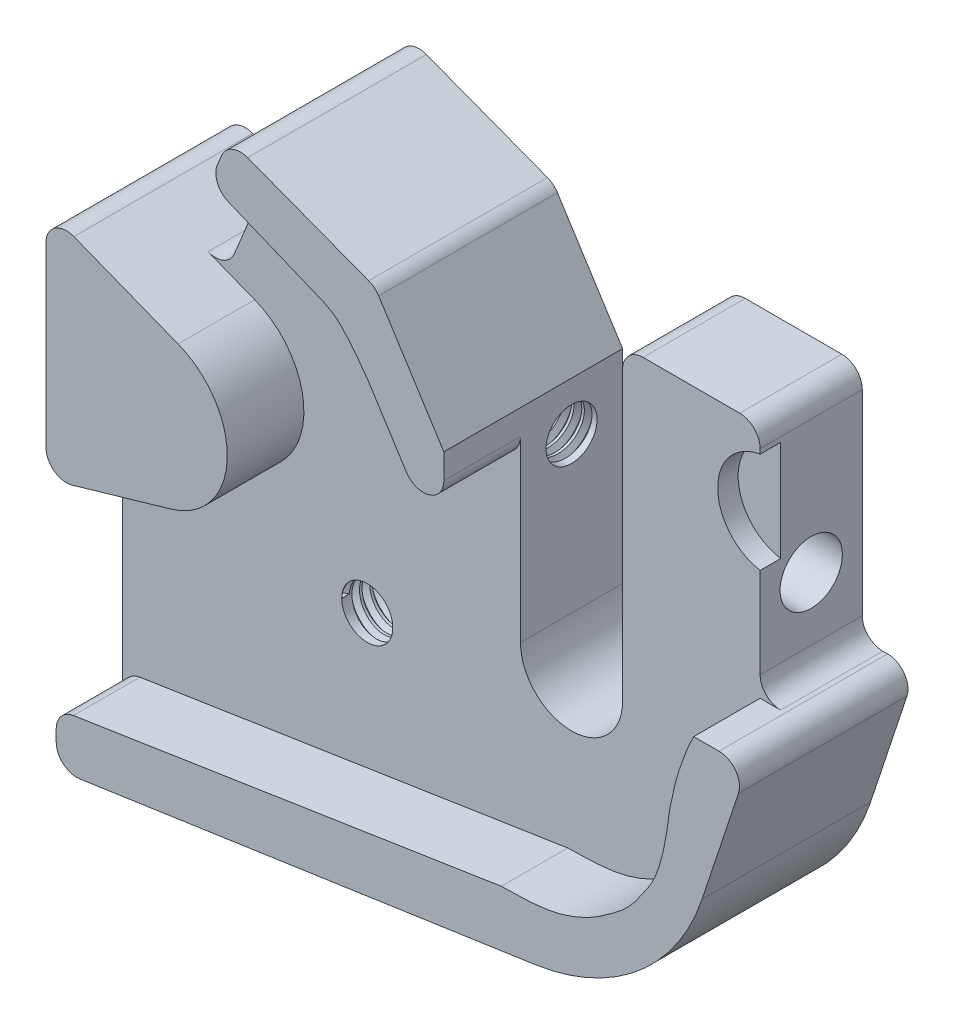
from build123d import *

# Parameters (mm, degrees)
BOSS_EXTRUDE1_DEPTH             = 10
SKETCH1_3_R                     = 7.578000113984699
BOSS_EXTRUDE2_DEPTH             = 17.5
BOSS_EXTRUDE3_DEPTH             = 16.5
SKETCH4_R                       = 3.0499999999999963
CUT_EXTRUDE2_DEPTH              = 30
TAP_DRILL_FOR_M6X1_0_TAP3_D     = 5
TAP_DRILL_FOR_M6X1_0_TAP3_DEPTH = 30
TAP_DRILL_FOR_M6X1_0_TAP3_TIP   = 1.5021515475689007
THREAD2_PITCH                   = 1
TAP_DRILL_FOR_M6X1_0_TAP4_D     = 5
TAP_DRILL_FOR_M6X1_0_TAP4_DEPTH = 30
TAP_DRILL_FOR_M6X1_0_TAP4_TIP   = 1.5021515475689007
THREAD3_PITCH                   = 1
FILLET1_R                       = 2
SKETCH16_R                      = 5.000000000000005
CUT_EXTRUDE3_DEPTH              = 2


with BuildPart() as part:
    # Sketch1 → Boss-Extrude1 (new body)
    with BuildSketch(Plane.XY):
        with BuildLine():
            Line((78.96827475522947, 38.5935556342534), (78.96827475522947, 42.187825253742076))
            Line((78.96827475522947, 42.187825253742076), (77.94135898527813, 43.80236991179886))
            Line((77.94135898527813, 43.80236991179886), (74.33675739276399, 49.46962171171273))
            ThreePointArc((74.33675739276399, 49.469621711712726), (63.688772453091616, 32.62392036907067), (72.5745325100122, 14.785744867864917))
            Line((72.5745325100123, 14.785744867865446), (83.59996436724236, 16.48818112450211))
            add(Edge.make_bspline(
                [(83.59996436724236, 16.48818112450211), (85.41724211796235, 16.53756568760866), (87.87798883539777, 16.519220276594933), (90.67264688620305, 17.4205412675626), (92.39490917260518, 18.177313617681204), (94.09982159977741, 19.337279052052818), (95.76190532502257, 20.5841697393974), (96.83810880091103, 21.893388892292066), (97.57220809756222, 23.021495021821945), (98.2993424213877, 24.012698516640828), (98.8168110615546, 25.180735972728453), (99.33817141463199, 26.79477159166982), (99.7545174529146, 28.733058812999758), (99.97921580397463, 30.878234339552698), (100.41119186805449, 32.8730475280245), (100.84339117053993, 34.69276986008277), (101.41680498340376, 36.208847575811006), (101.85717784527546, 37.44613777913256), (102.23335830846185, 38.17303090912317), (102.42203562576773, 38.57258948818388), (102.43189182699052, 38.59355563425327)],
                knots=[0, 0, 0, 0, 0.15768366072338366, 0.20676134981541355, 0.2516981863893839, 0.31900050382694334, 0.38365759589069376, 0.42951420214431174, 0.46378751400899093, 0.4995429911697522, 0.5348783172354219, 0.5730312186558052, 0.6454047552386061, 0.7048490244263054, 0.7583603601988523, 0.8208523578081605, 0.8654225677826217, 0.8976768321542437, 0.9336890739628735, 0.935681800308007, 0.935681800308007, 0.935681800308007, 0.935681800308007], degree=3))
            Line((102.43189182699051, 38.59355563425329), (88.96827475522947, 38.59355563425329))
            Line((88.96827475522946, 38.59355563425329), (88.96827475522947, 31.5935556342533))
            Line((88.96827475522947, 31.5935556342533), (88.96827475522947, 26.59355563425329))
            Line((88.96827475522947, 26.59355563425329), (83.96827475522934, 26.59355563425329))
            Line((83.96827475522934, 26.59355563425329), (78.96827475522947, 26.59355563425329))
            Line((78.96827475522947, 26.59355563425329), (78.96827475522947, 31.5935556342533))
            Line((78.96827475522947, 31.5935556342533), (78.96827475522947, 38.5935556342534))
        make_face()
        with BuildLine():
            Line((88.96827475522946, 51.27399935661806), (88.96827475522946, 43.59355563425329))
            Line((88.96827475522946, 43.59355563425329), (88.96827475522946, 38.59355563425329))
            Line((88.96827475522947, 38.59355563425329), (102.43189182699051, 38.59355563425329))
            Line((102.43189182699051, 38.593555634253285), (102.43189182699051, 40.04427807298856))
            ThreePointArc((102.43189182699052, 40.04427807298856), (96.97450370714176, 47.18707587695694), (88.96827475522963, 51.273999356618106))
        make_face()
        with BuildLine():
            Line((88.96827475522947, 61.76545821531718), (88.96827475522946, 51.27399935661806))
            ThreePointArc((88.96827475522963, 51.273999356618106), (96.97450370714176, 47.18707587695694), (102.43189182699052, 40.04427807298856))
            Line((102.43189182699051, 40.04427807298856), (102.43189182699051, 40.58090115148971))
            Line((102.43189182699051, 40.58090115148971), (102.43189182699051, 47.013590676817664))
            ThreePointArc((102.43189182699058, 47.01359067681767), (95.87453273292697, 54.36545821531712), (102.43189182699047, 61.71732575381667))
            Line((102.43189182699051, 61.71732575381667), (102.43189182699051, 61.76545821531718))
            Line((102.43189182699051, 61.76545821531718), (88.96827475522947, 61.76545821531718))
        make_face()
        with BuildLine():
            Line((88.96827475522947, 26.59355563425329), (88.96827475522947, 31.5935556342533))
            ThreePointArc((88.96827475522946, 31.5935556342533), (87.50380866116215, 28.058021728320522), (83.96827475522934, 26.59355563425331))
            Line((83.96827475522934, 26.59355563425329), (88.96827475522947, 26.59355563425329))
        make_face()
        with BuildLine():
            ThreePointArc((83.96827475522934, 26.59355563425331), (80.43274084929669, 28.058021728320615), (78.96827475522949, 31.5935556342533))
            Line((78.96827475522947, 31.5935556342533), (78.96827475522947, 26.59355563425329))
            Line((78.96827475522947, 26.59355563425329), (83.96827475522934, 26.59355563425329))
        make_face()
        with BuildLine():
            ThreePointArc((72.5745325100122, 14.785744867864917), (63.688772453091616, 32.62392036907067), (74.33675739276399, 49.469621711712726))
            Line((74.33675739276399, 49.46962171171273), (71.54074542683735, 53.865587102003296))
            add(Edge.make_bspline(
                [(67.16681294608784, 58.3330475317527), (67.53066578937492, 58.148158454940294), (68.21626704277061, 57.829717753599276), (69.73754280760359, 56.33759113466666), (70.7671129056723, 54.99803586851407), (71.54074542683735, 53.865587102003296)],
                knots=[0, 0, 0, 0, 0.19417637174294056, 0.35338295041403034, 1, 1, 1, 1], degree=3))
            Line((67.16681294608784, 58.3330475317527), (56.03811631838445, 62.90331689854259))
            Line((56.03811631838445, 62.90331689854259), (50.21233359803197, 48.7174203330503))
            Line((50.21233359803197, 48.7174203330503), (52.95464713088683, 47.643030748312306))
            ThreePointArc((52.95464713088681, 47.64303074831224), (56.45026737101809, 44.85792603920894), (57.76830437309072, 40.58721795212874))
            ThreePointArc((57.76830437309072, 40.58721795212874), (56.24935802543311, 36.03595953446999), (52.30143900683574, 33.30922401118043))
            Line((52.30143900683574, 33.30922401118043), (40.01978708427511, 29.746673468318164))
            Line((40.019787084275116, 29.746673468318164), (40.019787084275116, 9.758968623993628))
            Line((40.019787084275116, 9.758968623993628), (72.5745325100123, 14.785744867865446))
        make_face()
        with BuildLine():
            Line((102.43189182699051, 58.68401773252229), (102.43189182699051, 61.71732575381667))
            ThreePointArc((102.43189182699047, 61.71732575381667), (95.87453273292697, 54.36545821531712), (102.43189182699058, 47.01359067681767))
            Line((102.43189182699051, 47.013590676817664), (102.43189182699051, 50.04689869811206))
            ThreePointArc((102.43189182699061, 50.04689869811208), (98.87453273292698, 54.365458215317176), (102.43189182699061, 58.68401773252227))
        make_face()
        with BuildLine():
            Line((102.43189182699051, 50.04689869811206), (102.43189182699051, 58.68401773252229))
            ThreePointArc((102.43189182699061, 58.68401773252227), (98.87453273292698, 54.365458215317176), (102.43189182699061, 50.04689869811208))
        make_face()
    extrude(amount=BOSS_EXTRUDE1_DEPTH)

    # Sketch1<3> → Boss-Extrude2 (add)
    with BuildSketch(Plane.XY):
        with BuildLine():
            ThreePointArc((74.33675739276399, 49.469621711712726), (76.59709644010309, 50.514062904297106), (78.96827475522967, 51.27399935661819))
            Line((78.96827475522947, 51.27399935661824), (78.96827475522947, 51.504339637287444))
            Line((78.96827475522947, 51.504339637287444), (77.99321410117432, 53.03735628417434))
            Line((77.99321410117432, 53.03735628417434), (72.23104068023561, 62.09680067854197))
            Line((72.2310406802356, 62.09680067854197), (70.50082285395956, 62.75430218344684))
            Line((70.50082285395956, 62.75430218344684), (57.93755222306168, 67.52848103011922))
            Line((57.93755222306168, 67.52848103011922), (56.03811631838445, 62.90331689854259))
            Line((56.03811631838445, 62.90331689854259), (67.16681294608784, 58.3330475317527))
            add(Edge.make_bspline(
                [(67.16681294608784, 58.3330475317527), (67.53066578937492, 58.148158454940294), (68.21626704277061, 57.829717753599276), (69.73754280760359, 56.33759113466666), (70.7671129056723, 54.99803586851407), (71.54074542683735, 53.865587102003296)],
                knots=[0, 0, 0, 0, 0.19417637174294056, 0.35338295041403034, 1, 1, 1, 1], degree=3))
            Line((71.54074542683735, 53.865587102003296), (74.33675739276399, 49.46962171171273))
        make_face()
        with BuildLine():
            Line((78.96827475522947, 42.187825253742076), (78.96827475522947, 43.59355563425329))
            Line((78.96827475522947, 43.59355563425329), (78.96827475522947, 49.44154603091854))
            Line((78.96827475522947, 49.44154603091854), (78.96827475522947, 51.27399935661824))
            ThreePointArc((78.96827475522967, 51.27399935661819), (76.59709644010309, 50.514062904297106), (74.33675739276399, 49.469621711712726))
            Line((74.33675739276399, 49.46962171171273), (77.94135898527813, 43.80236991179886))
            Line((77.94135898527813, 43.80236991179886), (78.96827475522947, 42.187825253742076))
        make_face()
        with Locations((50.19030425910602, 40.58721795212874)):
            Circle(SKETCH1_3_R)
        with BuildLine():
            Line((52.95464713088683, 47.643030748312306), (50.21233359803197, 48.7174203330503))
            Line((50.21233359803197, 48.7174203330503), (40.01978708427513, 52.710678465331654))
            Line((40.01978708427513, 52.71067846533165), (40.01978708427513, 47.34063824296787))
            Line((40.01978708427513, 47.34063824296787), (44.49575262392416, 45.58703468895018))
            ThreePointArc((44.49575262392417, 45.58703468895018), (48.4005247200828, 47.95082949329833), (52.95464713088681, 47.64303074831224))
        make_face()
        with BuildLine():
            Line((40.01978708427513, 47.34063824296787), (40.019787084275116, 35.746673468318164))
            Line((40.01978708427511, 35.74667346831816), (43.63005434703988, 36.79390715299979))
            ThreePointArc((43.63005434703988, 36.79390715299979), (42.648765078906784, 41.32969523869845), (44.49575262392417, 45.58703468895018))
            Line((44.49575262392416, 45.58703468895018), (40.01978708427513, 47.34063824296787))
        make_face()
        with BuildLine():
            Line((40.019787084275116, 35.746673468318164), (40.019787084275116, 29.746673468318164))
            Line((40.01978708427511, 29.746673468318164), (52.30143900683574, 33.30922401118043))
            ThreePointArc((52.30143900683574, 33.30922401118043), (47.364634323302816, 33.55574050130448), (43.63005434703988, 36.79390715299979))
            Line((43.63005434703988, 36.79390715299979), (40.01978708427511, 35.74667346831816))
        make_face()
    extrude(amount=BOSS_EXTRUDE2_DEPTH)

    # Sketch1<4> → Boss-Extrude3 (add)
    with BuildSketch(Plane.XY):
        with BuildLine():
            Line((107.67772976593382, 38.59355563425329), (103.02922607223287, 38.59355563425329))
            ThreePointArc((103.02922607223283, 38.59355563425314), (103.96033667026587, 35.14845724956152), (104.27393566811703, 31.5935556342533))
            ThreePointArc((104.27393566811703, 31.593555634253295), (104.01478060289041, 28.359754711366204), (103.24393044408335, 25.208497852688204))
            Line((103.24393044408342, 25.208497852688183), (107.67772976593382, 38.59355563425329))
        make_face()
        with BuildLine():
            Line((103.02922607223287, 38.59355563425329), (102.43189182699051, 38.59355563425329))
            add(Edge.make_bspline(
                [(83.59996436724236, 16.48818112450211), (85.41724211796235, 16.53756568760866), (87.87798883539777, 16.519220276594933), (90.67264688620305, 17.4205412675626), (92.39490917260518, 18.177313617681204), (94.09982159977741, 19.337279052052818), (95.76190532502257, 20.5841697393974), (96.83810880091103, 21.893388892292066), (97.57220809756222, 23.021495021821945), (98.2993424213877, 24.012698516640828), (98.8168110615546, 25.180735972728453), (99.33817141463199, 26.79477159166982), (99.7545174529146, 28.733058812999758), (99.97921580397463, 30.878234339552698), (100.41119186805449, 32.8730475280245), (100.84339117053993, 34.69276986008277), (101.41680498340376, 36.208847575811006), (101.85717784527546, 37.44613777913256), (102.23335830846185, 38.17303090912317), (102.42203562576773, 38.57258948818388), (102.43189182699052, 38.59355563425327)],
                knots=[0, 0, 0, 0, 0.15768366072338366, 0.20676134981541355, 0.2516981863893839, 0.31900050382694334, 0.38365759589069376, 0.42951420214431174, 0.46378751400899093, 0.4995429911697522, 0.5348783172354219, 0.5730312186558052, 0.6454047552386061, 0.7048490244263054, 0.7583603601988523, 0.8208523578081605, 0.8654225677826217, 0.8976768321542437, 0.9336890739628735, 0.935681800308007, 0.935681800308007, 0.935681800308007, 0.935681800308007], degree=3))
            Line((83.59996436724236, 16.48818112450211), (72.5745325100123, 14.785744867865446))
            ThreePointArc((72.5745325100122, 14.785744867864917), (79.43931899005581, 11.799404357013096), (86.91969219864855, 11.50353323048651))
            ThreePointArc((86.91969219864855, 11.50353323048651), (97.02458391328798, 16.041942975806347), (103.24393044408335, 25.208497852688204))
            ThreePointArc((103.24393044408335, 25.208497852688204), (104.01478060289041, 28.359754711366204), (104.27393566811703, 31.593555634253295))
            ThreePointArc((104.27393566811703, 31.5935556342533), (103.96033667026587, 35.14845724956152), (103.02922607223283, 38.59355563425314))
        make_face()
        with BuildLine():
            ThreePointArc((86.91969219864855, 11.50353323048651), (79.43931899005581, 11.799404357013096), (72.5745325100122, 14.785744867864917))
            Line((72.5745325100123, 14.785744867865446), (40.019787084275116, 9.758968623993628))
            Line((40.019787084275116, 9.758968623993628), (40.019787084275116, 4.613486235158945))
            Line((40.019787084275116, 4.6134862351589465), (86.91969219864855, 11.50353323048651))
        make_face()
    extrude(amount=BOSS_EXTRUDE3_DEPTH)

    # Sketch4 → Cut-Extrude2 (cut)
    with BuildSketch(Plane.ZY.offset(-88.9682747552295)):
        with Locations((5.000000000000002, 46.76545821531712)):
            Circle(SKETCH4_R)
    extrude(amount=-CUT_EXTRUDE2_DEPTH, mode=Mode.SUBTRACT)

    # Tap Drill for M6x1.0 Tap3
    with Locations(Plane(origin=(88.968274755, 46.765458215, 5), x_dir=(0, 1, 0), z_dir=(1, 0, 0))):
        with Locations((0, 0)):
            Hole(TAP_DRILL_FOR_M6X1_0_TAP3_D / 2, depth=TAP_DRILL_FOR_M6X1_0_TAP3_DEPTH)
            with Locations((0, 0, -(TAP_DRILL_FOR_M6X1_0_TAP3_DEPTH + TAP_DRILL_FOR_M6X1_0_TAP3_TIP / 2))):  # 118° drill point
                Cone(0, TAP_DRILL_FOR_M6X1_0_TAP3_D / 2, TAP_DRILL_FOR_M6X1_0_TAP3_TIP, mode=Mode.SUBTRACT)

    # Thread2: the profile of Thread Profile2 profile screwed along a right-hand helix of 20 turns, 8 arcs to a turn; built about Z, then put on its axis
    thread2_z = Axis((0, 0, 0), (0, 0, 1))
    thread2_corners = [(2.4997, 0, -0.000173205), (3.041265875, 0, 0.312499998), (3.041265875, 0, 0.437499998), (2.4997, 0, 0.750173202)]
    with BuildLine(mode=Mode.PRIVATE) as thread2_profile:
        Line(thread2_corners[0], thread2_corners[1])
        Line(thread2_corners[1], thread2_corners[2])
        Line(thread2_corners[2], thread2_corners[3])
        Line(thread2_corners[3], thread2_corners[0])
    thread2_cap = Face(thread2_profile.wire())
    thread2_turn_angles = [0, 22.5, 45, 67.5, 90, 112.5, 135, 157.5, 180, 202.5, 225, 247.5, 270, 292.5, 315, 337.5, 360]
    thread2_turn_weights = [1, 0.9238795325112867, 1, 0.9238795325112867, 1, 0.9238795325112867, 1, 0.9238795325112867, 1, 0.9238795325112867, 1, 0.9238795325112867, 1, 0.9238795325112867, 1, 0.9238795325112867, 1]
    thread2_turn_rails = [Edge.make_bspline([Vector(p[0], p[1], 0).rotate(thread2_z, thread2_turn_angles[k]) / thread2_turn_weights[k] + Vector(0, 0, p[2] + THREAD2_PITCH * thread2_turn_angles[k] / 360) for k in range(17)], [0, 0, 0, 1, 1, 2, 2, 3, 3, 4, 4, 5, 5, 6, 6, 7, 7, 8, 8, 8], 2, thread2_turn_weights) for p in thread2_corners]
    thread2_turn_sides = [Face.make_surface_from_curves(thread2_turn_rails[p[0]], thread2_turn_rails[p[1]]) for p in [(0, 1), (1, 2), (2, 3), (3, 0)]]
    thread2 = Plane(origin=(78.968274755, 46.765458215, 5), x_dir=(0, 0, 1), z_dir=(-1, 0, 0)) * Solid(Shell([*[p.moved(Location((0, 0, THREAD2_PITCH * i))) for i in range(20) for p in thread2_turn_sides], thread2_cap, thread2_cap.rotate(thread2_z, 7200).moved(Location((0, 0, THREAD2_PITCH * 7200 / 360)))]))
    add(thread2, mode=Mode.SUBTRACT)

    # Tap Drill for M6x1.0 Tap4
    with Locations(Plane(origin=(63.968274755, 26.593555634, 10), x_dir=(1, 0, 0), z_dir=(0, 0, 1))):
        with Locations((0, 0)):
            Hole(TAP_DRILL_FOR_M6X1_0_TAP4_D / 2, depth=TAP_DRILL_FOR_M6X1_0_TAP4_DEPTH)
            with Locations((0, 0, -(TAP_DRILL_FOR_M6X1_0_TAP4_DEPTH + TAP_DRILL_FOR_M6X1_0_TAP4_TIP / 2))):  # 118° drill point
                Cone(0, TAP_DRILL_FOR_M6X1_0_TAP4_D / 2, TAP_DRILL_FOR_M6X1_0_TAP4_TIP, mode=Mode.SUBTRACT)

    # Thread3: the profile of Thread Profile3 profile screwed along a right-hand helix of 20 turns, 8 arcs to a turn; built about Z, then put on its axis
    thread3_z = Axis((0, 0, 0), (0, 0, 1))
    thread3_corners = [(2.4997, 0, -0.000173205), (3.041265875, 0, 0.312499999), (3.041265875, 0, 0.437499999), (2.4997, 0, 0.750173202)]
    with BuildLine(mode=Mode.PRIVATE) as thread3_profile:
        Line(thread3_corners[0], thread3_corners[1])
        Line(thread3_corners[1], thread3_corners[2])
        Line(thread3_corners[2], thread3_corners[3])
        Line(thread3_corners[3], thread3_corners[0])
    thread3_cap = Face(thread3_profile.wire())
    thread3_turn_angles = [0, 22.5, 45, 67.5, 90, 112.5, 135, 157.5, 180, 202.5, 225, 247.5, 270, 292.5, 315, 337.5, 360]
    thread3_turn_weights = [1, 0.9238795325112867, 1, 0.9238795325112867, 1, 0.9238795325112867, 1, 0.9238795325112867, 1, 0.9238795325112867, 1, 0.9238795325112867, 1, 0.9238795325112867, 1, 0.9238795325112867, 1]
    thread3_turn_rails = [Edge.make_bspline([Vector(p[0], p[1], 0).rotate(thread3_z, thread3_turn_angles[k]) / thread3_turn_weights[k] + Vector(0, 0, p[2] + THREAD3_PITCH * thread3_turn_angles[k] / 360) for k in range(17)], [0, 0, 0, 1, 1, 2, 2, 3, 3, 4, 4, 5, 5, 6, 6, 7, 7, 8, 8, 8], 2, thread3_turn_weights) for p in thread3_corners]
    thread3_turn_sides = [Face.make_surface_from_curves(thread3_turn_rails[p[0]], thread3_turn_rails[p[1]]) for p in [(0, 1), (1, 2), (2, 3), (3, 0)]]
    thread3 = Plane(origin=(63.968274755, 26.593555634, 10), x_dir=(-1, 0, 0), z_dir=(0, 0, -1)) * Solid(Shell([*[p.moved(Location((0, 0, THREAD3_PITCH * i))) for i in range(20) for p in thread3_turn_sides], thread3_cap, thread3_cap.rotate(thread3_z, 7200).moved(Location((0, 0, THREAD3_PITCH * 7200 / 360)))]))
    add(thread3, mode=Mode.SUBTRACT)

    # Fillet1
    fillet1_edges = [part.edges().sort_by_distance(p)[0] for p in [
        (102.43189182699051, 61.76545821531718, 5),
        (88.96827475522947, 61.76545821531718, 5),
        (57.93755222306168, 67.52848103011922, 8.75),
        (56.03811631838445, 62.90331689854259, 13.75),
        (78.96827475522947, 42.187825253742076, 13.75),
        (50.21233359803197, 48.7174203330503, 5),
        (40.01978708427511, 29.746673468318164, 13.75),
        (40.01978708427513, 52.710678465331654, 8.75),
        (72.2310406802356, 62.09680067854197, 8.75),
        (40.019787084275116, 4.613486235158946, 8.25),
        (40.019787084275116, 9.758968623993628, 13.25),
        (107.67772976593382, 38.59355563425329, 8.25),
        (102.43189182699052, 38.59355563425328, 5),
    ]]
    fillet(fillet1_edges, radius=FILLET1_R)

    # Sketch16 → Cut-Extrude3 (cut)
    with BuildSketch(Plane.XY.offset(10)):
        with Locations((103.27453273292697, 54.36545821531718)):
            Circle(SKETCH16_R)
    extrude(amount=-CUT_EXTRUDE3_DEPTH, mode=Mode.SUBTRACT)


solid = part.part
